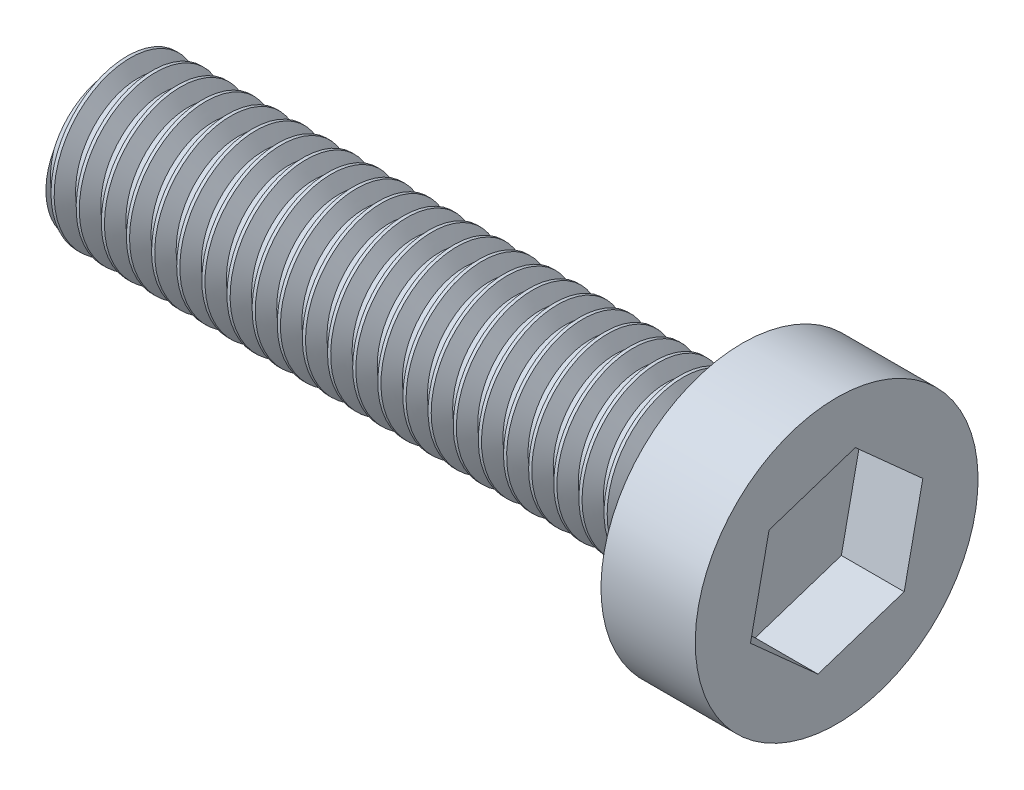
from build123d import *

# Parameters (mm, degrees)
THREAD1_PITCH      = 0.8
THREAD1_TO         = 23
CUT_EXTRUDE1_DEPTH = 2


with BuildPart() as part:
    # Sketch1 → Revolve1 (revolve)
    with BuildSketch(Plane.XY):
        Polygon((-1.39042871, 2.5), (18.60957129, 2.5), (18.60957129, 4.5), (21.60957129, 4.5), (21.60957129, 0), (-1.39042871, 0), align=None)
    revolve(axis=Axis((21.60957129, 0, 0), (-1, 0, 0)))

    # Thread1: arcs per turn and ends read off the stored shape
    # Thread1: the profile of Thread Profile1 profile screwed along a right-hand helix through 28.75 turns, 8 arcs to a turn; built about Z, then put on its axis
    thread1_z = Axis((0, 0, 0), (0, 0, 1))
    thread1_corners = [(2.5003, 0, -0.000173205), (2.5003, 0, 0.700173203), (2.0669873, 0, 0.449999999), (2.0669873, 0, 0.249999999)]
    with BuildLine(mode=Mode.PRIVATE) as thread1_profile:
        Line(thread1_corners[0], thread1_corners[1])
        Line(thread1_corners[1], thread1_corners[2])
        Line(thread1_corners[2], thread1_corners[3])
        Line(thread1_corners[3], thread1_corners[0])
    thread1_cap = Face(thread1_profile.wire())
    thread1_turn_angles = [0, 22.5, 45, 67.5, 90, 112.5, 135, 157.5, 180, 202.5, 225, 247.5, 270, 292.5, 315, 337.5, 360]
    thread1_turn_weights = [1, 0.9238795325112867, 1, 0.9238795325112867, 1, 0.9238795325112867, 1, 0.9238795325112867, 1, 0.9238795325112867, 1, 0.9238795325112867, 1, 0.9238795325112867, 1, 0.9238795325112867, 1]
    thread1_turn_rails = [Edge.make_bspline([Vector(p[0], p[1], 0).rotate(thread1_z, thread1_turn_angles[k]) / thread1_turn_weights[k] + Vector(0, 0, p[2] + THREAD1_PITCH * thread1_turn_angles[k] / 360) for k in range(17)], [0, 0, 0, 1, 1, 2, 2, 3, 3, 4, 4, 5, 5, 6, 6, 7, 7, 8, 8, 8], 2, thread1_turn_weights) for p in thread1_corners]
    thread1_turn_sides = [Face.make_surface_from_curves(thread1_turn_rails[p[0]], thread1_turn_rails[p[1]]) for p in [(0, 1), (1, 2), (2, 3), (3, 0)]]
    thread1_last_angles = [10080, 10102.5, 10125, 10147.5, 10170, 10192.5, 10215, 10237.5, 10260, 10282.5, 10305, 10327.5, 10350]
    thread1_last_weights = [1, 0.9238795325112867, 1, 0.9238795325112867, 1, 0.9238795325112867, 1, 0.9238795325112867, 1, 0.9238795325112867, 1, 0.9238795325112867, 1]
    thread1_last_rails = [Edge.make_bspline([Vector(p[0], p[1], 0).rotate(thread1_z, thread1_last_angles[k]) / thread1_last_weights[k] + Vector(0, 0, p[2] + THREAD1_PITCH * thread1_last_angles[k] / 360) for k in range(13)], [0, 0, 0, 1, 1, 2, 2, 3, 3, 4, 4, 5, 5, 6, 6, 6], 2, thread1_last_weights) for p in thread1_corners]
    thread1_last_sides = [Face.make_surface_from_curves(thread1_last_rails[p[0]], thread1_last_rails[p[1]]) for p in [(0, 1), (1, 2), (2, 3), (3, 0)]]
    thread1 = Plane(origin=(-4.39042871, 0, 0), x_dir=(0, 0, -1), z_dir=(1, 0, 0)) * split(Solid(Shell([*[p.moved(Location((0, 0, THREAD1_PITCH * i))) for i in range(28) for p in thread1_turn_sides], *thread1_last_sides, thread1_cap, thread1_cap.rotate(thread1_z, 10350).moved(Location((0, 0, THREAD1_PITCH * 10350 / 360)))])), bisect_by=Plane.XY.offset(THREAD1_TO), keep=Keep.BOTTOM, mode=Mode.PRIVATE)
    add(thread1, mode=Mode.SUBTRACT)

    # Sketch6 → Cut-Extrude1 (cut)
    with BuildSketch(Plane(origin=(21.60957129, 0, 0), x_dir=(0, 0, -1), z_dir=(1, 0, 0))):
        Polygon((2.150011318, -1.926339706), (2.743264781, 0.898794567), (0.593253463, 2.825134273), (-2.150011318, 1.926339706), (-2.743264781, -0.898794567), (-0.593253463, -2.825134273), align=None)
    extrude(amount=-CUT_EXTRUDE1_DEPTH, mode=Mode.SUBTRACT)


solid = part.part
